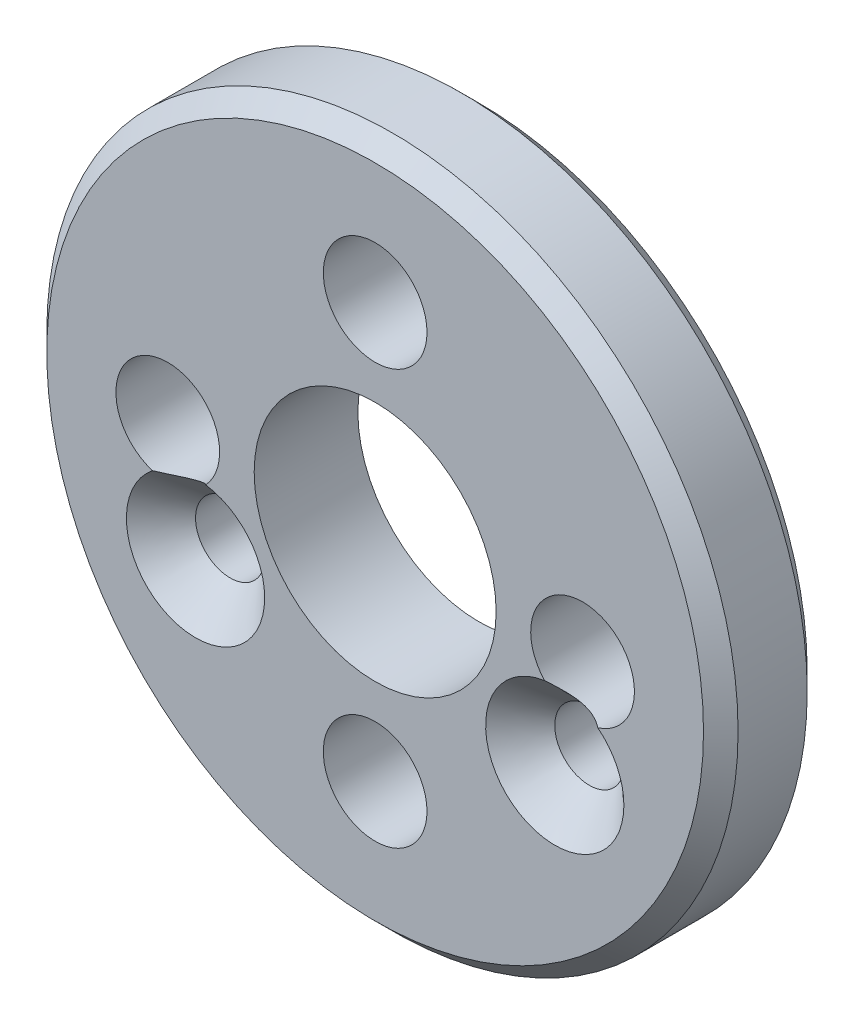
from build123d import *

# Parameters (mm, degrees)
SKETCH_1_R      = 10
SKETCH_1_R_2    = 1.5
SKETCH_1_R_3    = 3.5
SKETCH_1_R_4    = 1
EXTRUDE_1_DEPTH = 3
CHAMFER_1_SIZE  = 0.5
CHAMFER_2_SIZE  = 1


with BuildPart() as part:
    # 草图1 → 凸台-拉伸1 (new body)
    with BuildSketch(Plane.XY):
        Circle(SKETCH_1_R)
        with Locations((-6, 0)):
            Circle(SKETCH_1_R_2, mode=Mode.SUBTRACT)
        with Locations((0, -6)):
            Circle(SKETCH_1_R_2, mode=Mode.SUBTRACT)
        with Locations((6, 0)):
            Circle(SKETCH_1_R_2, mode=Mode.SUBTRACT)
        Circle(SKETCH_1_R_3, mode=Mode.SUBTRACT)
        with Locations((0, 6)):
            Circle(SKETCH_1_R_2, mode=Mode.SUBTRACT)
        with Locations((5.196152423, -3)):
            Circle(SKETCH_1_R_4, mode=Mode.SUBTRACT)
        with Locations((-5.196152423, -3)):
            Circle(SKETCH_1_R_4, mode=Mode.SUBTRACT)
    extrude(amount=EXTRUDE_1_DEPTH)

    # 倒角1
    chamfer_1_edges = [part.edges().sort_by_distance(p)[0] for p in [
        (-10, 0, 0),
        (-10, 0, 3),
    ]]
    chamfer(chamfer_1_edges, length=CHAMFER_1_SIZE)

    # 倒角2
    # the kernel refuses this chamfer: 1 mm, written as the material it takes off along each edge
    with BuildSketch(Plane(origin=(5.196152423, -3, 3), x_dir=(1, 0, 0), z_dir=(0, -1, 0))) as chamfer_2_piece_1:
        Polygon((1 + CHAMFER_2_SIZE, 0), (1, -CHAMFER_2_SIZE), (1, 0), align=None)
    revolve(axis=Axis((5.196152423, -3, 3), (0, 0, 1)), mode=Mode.SUBTRACT)
    with BuildSketch(Plane(origin=(-5.196152423, -3, 3), x_dir=(1, 0, 0), z_dir=(0, -1, 0))) as chamfer_2_piece_2:
        Polygon((1 + CHAMFER_2_SIZE, 0), (1, -CHAMFER_2_SIZE), (1, 0), align=None)
    revolve(axis=Axis((-5.196152423, -3, 3), (0, 0, 1)), mode=Mode.SUBTRACT)


solid = part.part
